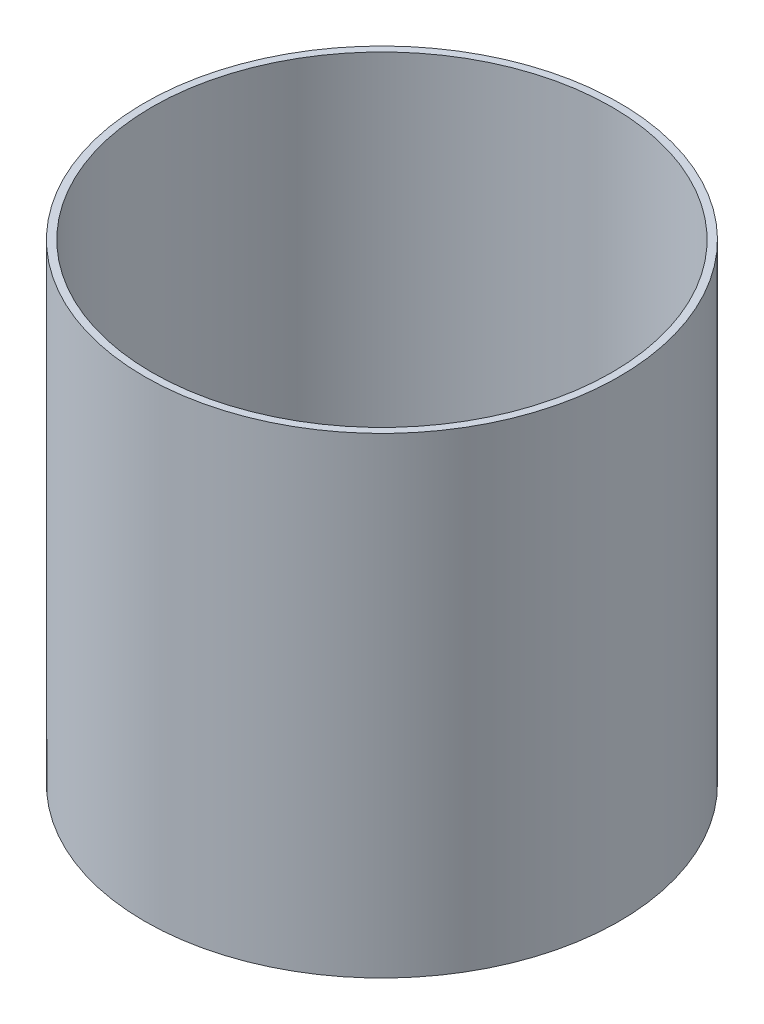
from build123d import *

# Parameters (mm, degrees)
SKETCH1_R           = 51.1048
SKETCH1_R_2         = 49.53
BOSS_EXTRUDE1_DEPTH = 101.6


with BuildPart() as part:
    # Sketch1 → Boss-Extrude1 (new body)
    with BuildSketch(Plane(origin=(0, 0, 0), x_dir=(1, 0, 0), z_dir=(0, 1, 0))):
        Circle(SKETCH1_R)
        Circle(SKETCH1_R_2, mode=Mode.SUBTRACT)
    extrude(amount=BOSS_EXTRUDE1_DEPTH)


solid = part.part
